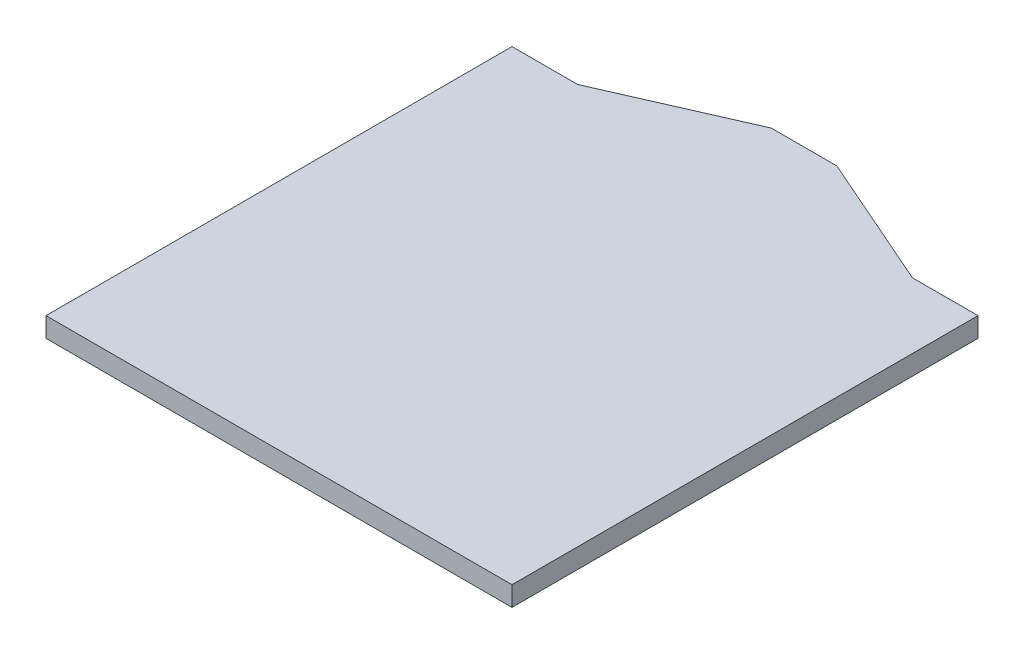
from build123d import *

# Parameters (mm, degrees)
BOSS_EXTRUDE1_DEPTH = 3


with BuildPart() as part:
    # Sketch1 → Boss-Extrude1 (new body)
    with BuildSketch(Plane(origin=(0, 0, 0), x_dir=(1, 0, 0), z_dir=(0, 1, 0))):
        Polygon((-25.5, 35.5), (-35.5, 35.5), (-35.5, -35.5), (35.5, -35.5), (35.5, 35.5), (25.5, 35.5), (5, 44.5), (-5, 44.5), align=None)
    extrude(amount=BOSS_EXTRUDE1_DEPTH)


solid = part.part
